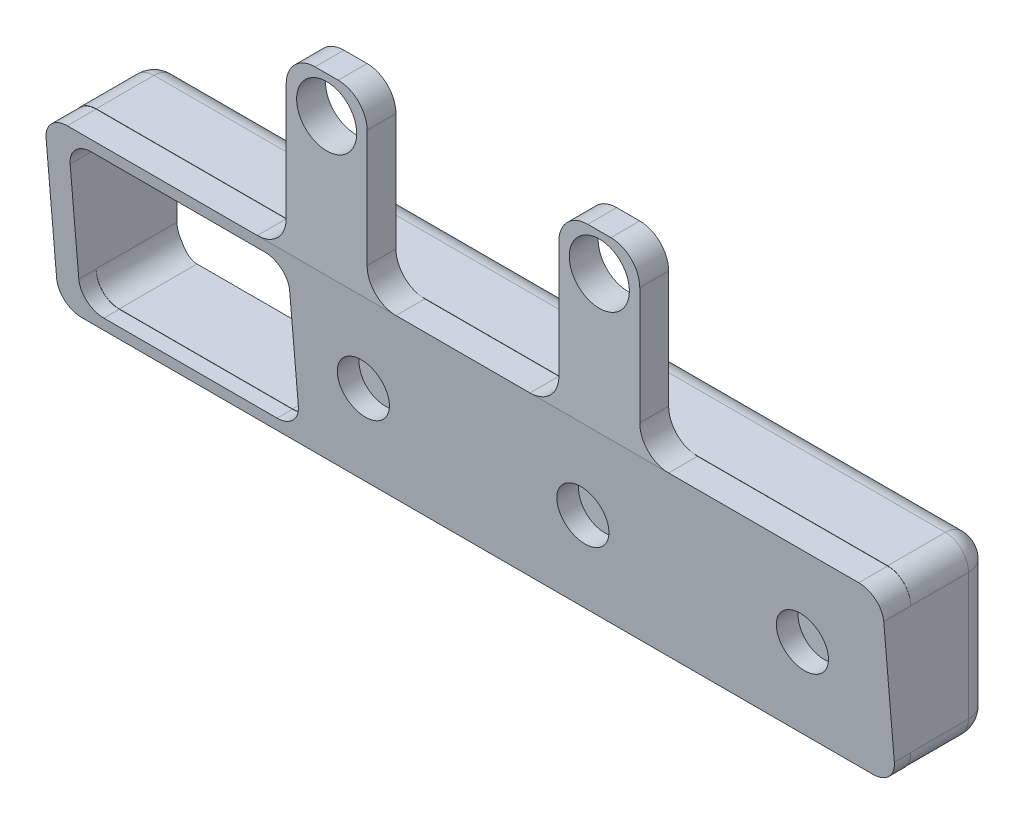
from build123d import *

# Parameters (mm, degrees)
SKETCH1_R           = 2.250000000000002
SKETCH1_R_2         = 2.249999999999999
SKETCH1_R_3         = 2.6000000000000005
SKETCH1_R_4         = 2.600000000000003
BOSS_EXTRUDE1_DEPTH = 2.5
BOSS_EXTRUDE2_DEPTH = 7
CUT_EXTRUDE1_DEPTH  = 78.57966290553851
FILLET1_R           = 2


with BuildPart() as part:
    # Sketch1 → Boss-Extrude1 (new body)
    with BuildSketch(Plane.XY):
        with BuildLine():
            Line((-24.24262981574538, 11.568676716917917), (-7.792629815745428, 11.568676716917919))
            ThreePointArc((-7.792629815745428, 11.568676716917919), (-6.024862862779042, 12.30090976395155), (-5.292629815745411, 14.068676716917937))
            Line((-5.292629815745411, 14.068676716917937), (-5.2926298157454115, 24.208689532378564))
            ThreePointArc((-5.2926298157454115, 24.208689532378564), (-4.5603967687117795, 25.976456485344933), (-2.7926298157454106, 26.70868953237856))
            Line((-2.7926298157454106, 26.70868953237856), (-0.7926298157454105, 26.70868953237856))
            ThreePointArc((-0.7926298157454105, 26.70868953237856), (0.975137137220956, 25.97645648534493), (1.7073701842545899, 24.208689532378564))
            Line((1.7073701842545899, 24.208689532378564), (1.707370184254591, 14.068676716917937))
            ThreePointArc((1.707370184254591, 14.068676716917937), (2.439603231288222, 12.30090976395155), (4.207370184254609, 11.568676716917919))
            Line((4.207370184254609, 11.568676716917919), (15.807370184254571, 11.568676716917919))
            ThreePointArc((15.807370184254571, 11.568676716917919), (17.575137137220956, 12.300909763951552), (18.307370184254587, 14.068676716917935))
            Line((18.307370184254587, 14.068676716917935), (18.30737018425459, 24.208689532378564))
            ThreePointArc((18.30737018425459, 24.208689532378564), (19.039603231288222, 25.976456485344933), (20.80737018425459, 26.708689532378564))
            Line((20.80737018425459, 26.708689532378564), (22.80737018425459, 26.708689532378568))
            ThreePointArc((22.80737018425459, 26.708689532378568), (24.575137137220963, 25.976456485344936), (25.307370184254594, 24.208689532378564))
            Line((25.307370184254594, 24.208689532378564), (25.307370184254594, 14.068676716917937))
            ThreePointArc((25.307370184254594, 14.068676716917937), (26.039603231288226, 12.300909763951552), (27.80737018425461, 11.568676716917919))
            Line((27.80737018425461, 11.568676716917919), (44.25737018425458, 11.568676716917917))
            ThreePointArc((44.25737018425458, 11.568676716917917), (45.67158374662769, 10.982890279291011), (46.2573701842546, 9.568676716917901))
            Line((46.2573701842546, 9.568676716917901), (46.25737018425459, -1.4313232830820677))
            ThreePointArc((46.25737018425459, -1.4313232830820677), (45.67158374662768, -2.845536845455177), (44.257370184254576, -3.431323283082082))
            Line((44.257370184254576, -3.431323283082082), (-24.242629815745374, -3.431323283082082))
            ThreePointArc((-24.242629815745374, -3.431323283082082), (-25.656843378118484, -2.8455368454551784), (-26.242629815745392, -1.4313232830820677))
            Line((-26.242629815745392, -1.4313232830820677), (-26.2426298157454, 9.568676716917903))
            ThreePointArc((-26.2426298157454, 9.568676716917903), (-25.65684337811849, 10.982890279291013), (-24.24262981574538, 11.568676716917917))
        make_face()
        with Locations((38.7573701842546, 4.068676716917918)):
            Circle(SKETCH1_R, mode=Mode.SUBTRACT)
        with Locations((19.757370184254597, 4.068676716917918)):
            Circle(SKETCH1_R_2, mode=Mode.SUBTRACT)
        with Locations((0.7573701842545979, 4.068676716917918)):
            Circle(SKETCH1_R_2, mode=Mode.SUBTRACT)
        with Locations((-1.7926298157454108, 23.50868953237856)):
            Circle(SKETCH1_R_3, mode=Mode.SUBTRACT)
        with Locations((21.80737018425459, 23.508689532378565)):
            Circle(SKETCH1_R_4, mode=Mode.SUBTRACT)
        with BuildLine():
            Line((-22.24262981574538, 10.568676716917917), (-7.242629815745397, 10.56867671691792))
            ThreePointArc((-7.242629815745397, 10.56867671691792), (-5.8284162533723025, 9.982890279291016), (-5.2426298157453965, 8.56867671691792))
            Line((-5.2426298157453965, 8.56867671691792), (-5.242629815745396, -0.43132328308208134))
            ThreePointArc((-5.242629815745396, -0.43132328308208134), (-5.828416253372301, -1.8455368454551766), (-7.242629815745396, -2.4313232830820817))
            Line((-7.242629815745396, -2.4313232830820817), (-22.24262981574538, -2.431323283082082))
            ThreePointArc((-22.24262981574538, -2.431323283082082), (-23.65684337811849, -1.8455368454551762), (-24.242629815745396, -0.43132328308206774))
            Line((-24.242629815745396, -0.43132328308206774), (-24.242629815745396, 8.568676716917903))
            ThreePointArc((-24.242629815745396, 8.568676716917903), (-23.65684337811849, 9.982890279291013), (-22.24262981574538, 10.568676716917917))
        make_face(mode=Mode.SUBTRACT)
    extrude(amount=BOSS_EXTRUDE1_DEPTH)

    # Sketch2 → Boss-Extrude2 (add)
    with BuildSketch(Plane(origin=(0, 0, 0), x_dir=(-1, 0, 0), z_dir=(0, 0, -1))):
        with BuildLine():
            Line((-44.2573701842546, 11.591990827848472), (24.242629815745396, 11.591990827848472))
            ThreePointArc((24.242629815745396, 11.591990827848472), (25.65684337811849, 11.006204390221566), (26.2426298157454, 9.591990827848472))
            Line((26.2426298157454, 9.591990827848472), (26.2426298157454, -1.408009172151513))
            ThreePointArc((26.2426298157454, -1.408009172151513), (25.65684337811849, -2.8222227345246234), (24.24262981574538, -3.4080091721515275))
            Line((24.24262981574538, -3.4080091721515275), (-44.25737018425458, -3.4080091721515275))
            ThreePointArc((-44.25737018425458, -3.4080091721515275), (-45.67158374662769, -2.8222227345246225), (-46.2573701842546, -1.4080091721515136))
            Line((-46.2573701842546, -1.4080091721515136), (-46.2573701842546, 9.591990827848472))
            ThreePointArc((-46.2573701842546, 9.591990827848472), (-45.67158374662769, 11.006204390221567), (-44.2573701842546, 11.591990827848472))
        make_face()
        with BuildLine():
            Line((7.242629815745404, 10.591990827848473), (22.242629815745403, 10.591990827848472))
            ThreePointArc((22.242629815745403, 10.591990827848472), (23.6568433781185, 10.006204390221566), (24.242629815745403, 8.591990827848472))
            Line((24.242629815745403, 8.591990827848472), (24.242629815745403, -0.4080091721515276))
            ThreePointArc((24.242629815745403, -0.4080091721515276), (23.6568433781185, -1.8222227345246227), (22.242629815745403, -2.408009172151528))
            Line((22.242629815745403, -2.408009172151528), (7.2426298157454045, -2.4080091721515275))
            ThreePointArc((7.2426298157454045, -2.4080091721515275), (5.8284162533723105, -1.8222227345246227), (5.242629815745405, -0.40800917215152854))
            Line((5.242629815745405, -0.40800917215152854), (5.242629815745403, 8.591990827848472))
            ThreePointArc((5.242629815745403, 8.591990827848472), (5.828416253372307, 10.006204390221567), (7.242629815745404, 10.591990827848473))
        make_face(mode=Mode.SUBTRACT)
    extrude(amount=BOSS_EXTRUDE2_DEPTH)

    # Sketch3 → Cut-Extrude1 (cut, through all)
    with BuildSketch(Plane.ZY.offset(26.242629815745392)):
        Polygon((2.5, 11.568676716917924), (1.25, -3.4313232830820675), (2.5, -3.431323283082067), align=None)
    extrude(amount=-CUT_EXTRUDE1_DEPTH, mode=Mode.SUBTRACT)

    # Fillet1
    # the kernel refuses this fillet: 2 mm, written as the material it takes off along each edge
    with BuildSketch(Plane(origin=(-24.24262981574539, 9.591990827848464, -7), x_dir=(-3.55e-15, 1, 0), z_dir=(1, 3.55e-15, 0))) as fillet1_piece_1:
        with BuildLine():
            CenterArc((2.000000000000009 - FILLET1_R, FILLET1_R), FILLET1_R, 270, 90)
            Line((2.000000000000009 - FILLET1_R, 0), (2.000000000000009, 0))
            Line((2.000000000000009, 0), (2.000000000000009, FILLET1_R))
        make_face()
    revolve(axis=Axis((-24.24262981574539, 9.591990827848464, -7), (0, 0, 1)), revolution_arc=89.99999999999959, mode=Mode.SUBTRACT)
    with BuildSketch(Plane(origin=(-26.2426298157454, 9.591990827848472, -7), x_dir=(0, 0, 1), z_dir=(0, -1, 0))) as fillet1_piece_2:
        with BuildLine():
            CenterArc((FILLET1_R, -FILLET1_R), FILLET1_R, 90, 89.99999999999989)
            Line((0, -FILLET1_R), (0, 0))
            Line((0, 0), (FILLET1_R, 0))
        make_face()
    extrude(amount=10.999999999999984, mode=Mode.SUBTRACT)
    with BuildSketch(Plane(origin=(-24.242629815745396, -1.4080091721515238, -7), x_dir=(-1, 5.33e-15, 0), z_dir=(5.33e-15, 1, 0))) as fillet1_piece_3:
        with BuildLine():
            CenterArc((2.0000000000000036 - FILLET1_R, FILLET1_R), FILLET1_R, 270.0000000000001, 89.99999999999989)
            Line((2.0000000000000036 - FILLET1_R, 0), (2.0000000000000036, 0))
            Line((2.0000000000000036, 0), (2.0000000000000036, FILLET1_R))
        make_face()
    revolve(axis=Axis((-24.242629815745396, -1.4080091721515238, -7), (0, 0, 1)), revolution_arc=90.00000000000071, mode=Mode.SUBTRACT)
    with BuildSketch(Plane(origin=(-24.24262981574538, -3.4080091721515275, -7), x_dir=(0, 1, 0), z_dir=(1, 0, 0))) as fillet1_piece_4:
        with BuildLine():
            CenterArc((FILLET1_R, FILLET1_R), FILLET1_R, 180, 90)
            Line((0, FILLET1_R), (0, 0))
            Line((0, 0), (FILLET1_R, 0))
        make_face()
    extrude(amount=68.49999999999997, mode=Mode.SUBTRACT)
    with BuildSketch(Plane(origin=(44.25737018425459, -1.408009172151522, -7), x_dir=(-3.55e-15, -1, 0), z_dir=(-1, 3.55e-15, 0))) as fillet1_piece_5:
        with BuildLine():
            CenterArc((2.000000000000006 - FILLET1_R, FILLET1_R), FILLET1_R, 270, 90)
            Line((2.000000000000006, FILLET1_R), (2.000000000000006, 0))
            Line((2.000000000000006, 0), (2.000000000000006 - FILLET1_R, 0))
        make_face()
    revolve(axis=Axis((44.25737018425459, -1.408009172151522, -7), (0, 0, 1)), revolution_arc=90.00000000000044, mode=Mode.SUBTRACT)
    with BuildSketch(Plane(origin=(46.2573701842546, -1.4080091721515136, -7), x_dir=(-3.55e-15, 0, 1), z_dir=(0, 1, 0))) as fillet1_piece_6:
        with BuildLine():
            CenterArc((FILLET1_R, -FILLET1_R), FILLET1_R, 90.0000000000002, 89.9999999999998)
            Line((7.11e-15, -FILLET1_R), (0, 0))
            Line((0, 0), (FILLET1_R, 0))
        make_face()
    extrude(amount=10.999999999999986, mode=Mode.SUBTRACT)
    with BuildSketch(Plane(origin=(44.2573701842546, 9.591990827848468, -7), x_dir=(1, 1.78e-15, 0), z_dir=(1.78e-15, -1, 0))) as fillet1_piece_7:
        with BuildLine():
            CenterArc((2 - FILLET1_R, FILLET1_R), FILLET1_R, 270, 90)
            Line((2, FILLET1_R), (2, 0))
            Line((2, 0), (2 - FILLET1_R, 0))
        make_face()
    revolve(axis=Axis((44.2573701842546, 9.591990827848468, -7), (0, 0, 1)), revolution_arc=89.9999999999999, mode=Mode.SUBTRACT)
    with BuildSketch(Plane(origin=(44.2573701842546, 11.591990827848472, -7), x_dir=(0, 0, 1), z_dir=(-1, 0, 0))) as fillet1_piece_8:
        with BuildLine():
            CenterArc((FILLET1_R, -FILLET1_R), FILLET1_R, 90, 90)
            Line((0, -FILLET1_R), (0, 0))
            Line((0, 0), (FILLET1_R, 0))
        make_face()
    extrude(amount=68.5, mode=Mode.SUBTRACT)


solid = part.part
